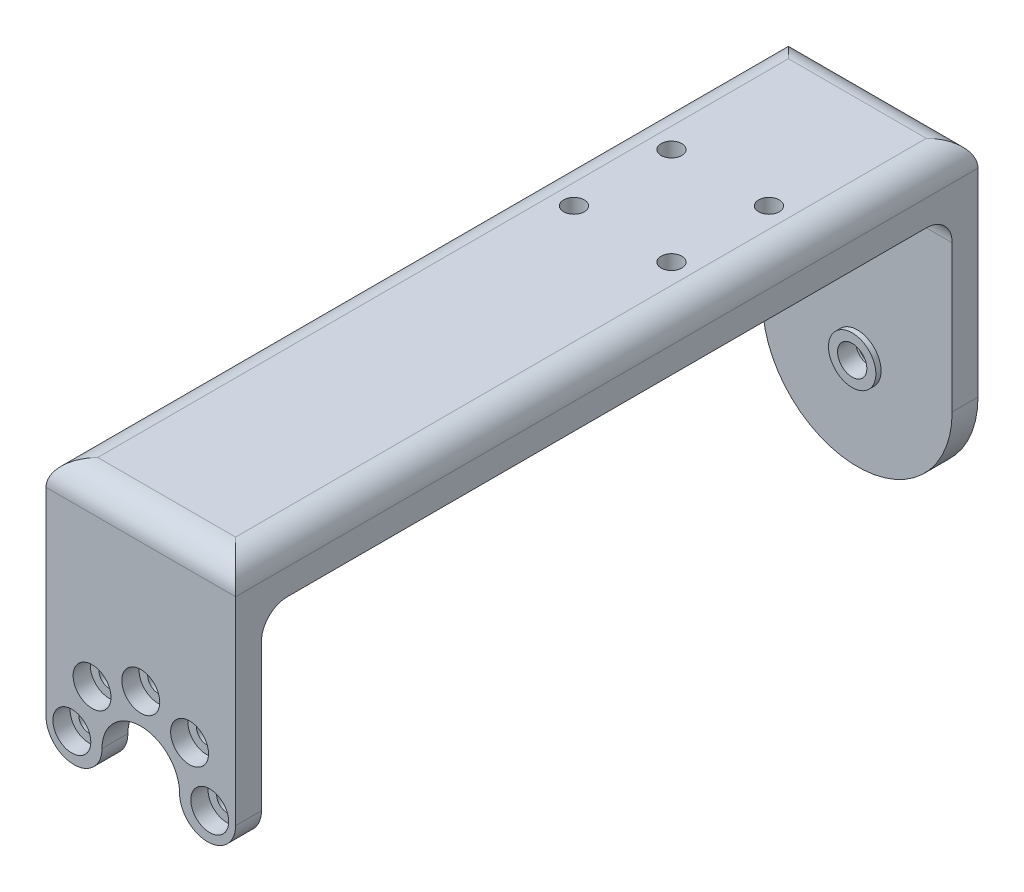
from build123d import *

# Parameters (mm, degrees)
RESSALTO_EXTRUS_O1_DEPTH                             = 3
ESBO_O2_W                                            = 22
ESBO_O2_H                                            = 86.15
RESSALTO_EXTRUS_O2_DEPTH                             = 3
RESSALTO_EXTRUS_O3_DEPTH                             = 3
REBAIXO_PARA_SHCS_M21_D                              = 2.4
REBAIXO_PARA_SHCS_M21_DEPTH                          = 3
REBAIXO_PARA_SHCS_M21_CBORE_D                        = 4.4
REBAIXO_PARA_SHCS_M21_CBORE_DEPTH                    = 2
PADR_OCIRCULAR1_COUNT                                = 5
PADR_OCIRCULAR1_ANGLE                                = 180
ESBO_O10_R                                           = 2.75
RESSALTO_EXTRUS_O4_DEPTH                             = 0.6
REBAIXO_PARA_PARAFUSO_COM_CABE_A_PANELA_D            = 3.4
REBAIXO_PARA_PARAFUSO_COM_CABE_A_PANELA_CBORE_D      = 7
REBAIXO_PARA_PARAFUSO_COM_CABE_A_PANELA_CBORE_DEPTH  = 1.5
ESBO_O14_W                                           = 86.15
ESBO_O14_H                                           = 6
RESSALTO_EXTRUS_O5_DEPTH                             = 3
REBAIXO_PARA_PARAFUSO_COM_CABE_A_REDONDA_D           = 2.4
REBAIXO_PARA_PARAFUSO_COM_CABE_A_REDONDA_CBORE_D     = 4.4
REBAIXO_PARA_PARAFUSO_COM_CABE_A_REDONDA_CBORE_DEPTH = 1
FILETE2_R                                            = 3
FILETE1_R                                            = 3


with BuildPart() as part:
    # Esboço1 → Ressalto-extrusão1 (new body)
    with BuildSketch(Plane.XY):
        with BuildLine():
            Line((11, 0), (11, 23))
            Line((11, 23), (-11, 23))
            Line((-11, 23), (-11, 0))
            ThreePointArc((-11, 0), (-7.75, -3.25), (-4.5, 0))
            ThreePointArc((-4.5, 0), (0, 4.5), (4.5, 0))
            ThreePointArc((4.5, 0), (7.75, -3.25), (11, 0))
        make_face()
    extrude(amount=RESSALTO_EXTRUS_O1_DEPTH)

    # Esboço2 → Ressalto-extrusão2 (add)
    with BuildSketch(Plane(origin=(0, 23, 0), x_dir=(1, 0, 0), z_dir=(0, 1, 0))):
        with Locations((0, 40.075)):
            Rectangle(ESBO_O2_W, ESBO_O2_H)
    extrude(amount=RESSALTO_EXTRUS_O2_DEPTH)

    # Esboço3 → Ressalto-extrusão3 (add)
    with BuildSketch(Plane(origin=(0, 0, -80.15), x_dir=(-1, 0, 0), z_dir=(0, 0, -1))):
        with BuildLine():
            Line((-11, 0), (-11, 23))
            Line((-11, 23), (11, 23))
            Line((11, 23), (11, 0))
            ThreePointArc((11, 0), (0, -11), (-11, 0))
        make_face()
    extrude(amount=RESSALTO_EXTRUS_O3_DEPTH)

    # Rebaixo para SHCS M21
    with Locations(Plane.XY.offset(3)):
        with Locations((8, 0)):
            rebaixo_para_shcs_m21 = CounterBoreHole(REBAIXO_PARA_SHCS_M21_D / 2, REBAIXO_PARA_SHCS_M21_CBORE_D / 2, REBAIXO_PARA_SHCS_M21_CBORE_DEPTH, depth=REBAIXO_PARA_SHCS_M21_DEPTH)

    # PadrãoCircular1: Rebaixo para SHCS M21 ×5 about axis
    padr_ocircular1_axis = Axis((0, 0, 0), (0, 0, 1))
    for i in range(1, PADR_OCIRCULAR1_COUNT):
        add(rebaixo_para_shcs_m21.rotate(padr_ocircular1_axis, i * PADR_OCIRCULAR1_ANGLE / (PADR_OCIRCULAR1_COUNT - 1)), mode=Mode.SUBTRACT)

    # Esboço10 → Ressalto-extrusão4 (add)
    with BuildSketch(Plane.XY.offset(-80.15)):
        with Locations(Location((0, 0, 0), (0, 0, 180))):
            Circle(ESBO_O10_R)
    extrude(amount=RESSALTO_EXTRUS_O4_DEPTH)

    # Rebaixo para parafuso com cabeça panela de M31 (through all)
    with Locations(Plane(origin=(0, 0, -83.15), x_dir=(-1, 0, 0), z_dir=(0, 0, -1))):
        with Locations((0, 0)):
            CounterBoreHole(REBAIXO_PARA_PARAFUSO_COM_CABE_A_PANELA_D / 2, REBAIXO_PARA_PARAFUSO_COM_CABE_A_PANELA_CBORE_D / 2, REBAIXO_PARA_PARAFUSO_COM_CABE_A_PANELA_CBORE_DEPTH)

    # Esboço14 → Ressalto-extrusão5 (add)
    with BuildSketch(Plane.ZY.offset(11)):
        with Locations((-40.075, 23)):
            Rectangle(ESBO_O14_W, ESBO_O14_H)
    ressalto_extrus_o5 = extrude(amount=-RESSALTO_EXTRUS_O5_DEPTH)

    # Espelhar2: Ressalto-extrusão5 across plane
    add(ressalto_extrus_o5.mirror(Plane(origin=(0, 0, 0), x_dir=(0, 0, 1), z_dir=(1, 0, 0))))

    # Rebaixo para parafuso com cabeça redonda de M21 (through all)
    with Locations(Plane(origin=(0, 23, 0), x_dir=(-1, 0, 0), z_dir=(0, -1, 0))):
        with Locations((5.656854249, 64.236417264), (5.656854249, 52.922708765), (-5.656854249, 52.922708765), (-5.656854249, 64.236417264)):
            CounterBoreHole(REBAIXO_PARA_PARAFUSO_COM_CABE_A_REDONDA_D / 2, REBAIXO_PARA_PARAFUSO_COM_CABE_A_REDONDA_CBORE_D / 2, REBAIXO_PARA_PARAFUSO_COM_CABE_A_REDONDA_CBORE_DEPTH)

    # Filete2
    filete2_edges = [part.edges().sort_by_distance(p)[0] for p in [
        (-9.5, 20, -80.15),
        (-9.5, 20, 0),
        (9.5, 20, -80.15),
        (9.5, 20, 0),
    ]]
    fillet(filete2_edges, radius=FILETE2_R)

    # Filete1
    # the kernel refuses this fillet: 3 mm, written as the material it adds along each edge
    with BuildSketch(Plane(origin=(8, 23, -80.15), x_dir=(0, 0, 1), z_dir=(-1, 0, 0))) as filete1_piece_1:
        with BuildLine():
            CenterArc((FILETE1_R, -FILETE1_R), FILETE1_R, 90, 90)
            Line((0, -FILETE1_R), (0, 0))
            Line((0, 0), (FILETE1_R, 0))
        make_face()
    extrude(amount=16)
    with BuildSketch(Plane(origin=(-8, 23, 0), x_dir=(0, -1, 0), z_dir=(0, 0, -1))) as filete1_piece_2_section:
        with BuildLine():
            CenterArc((FILETE1_R, -FILETE1_R), FILETE1_R, 90, 90)
            Line((0, -FILETE1_R), (0, 0))
            Line((0, 0), (FILETE1_R, 0))
        make_face()
    filete1_piece_2 = extrude(amount=80.15, mode=Mode.PRIVATE)
    filete1_piece_2 = filete1_piece_2 - Plane(origin=(-5.656854249, 22.304141759, -52.922708765), x_dir=(-1, 0, 0), z_dir=(0, -1, 0)) * Cylinder(2.2, 173, mode=Mode.PRIVATE)
    filete1_piece_2 = filete1_piece_2 - Plane(origin=(-5.656854249, 22.304141759, -64.236417264), x_dir=(-1, 0, 0), z_dir=(0, -1, 0)) * Cylinder(2.2, 173, mode=Mode.PRIVATE)
    add(filete1_piece_2)
    with BuildSketch(Plane(origin=(8, 23, 0), x_dir=(0, 0, -1), z_dir=(-1, 0, 0))) as filete1_piece_3:
        with BuildLine():
            CenterArc((FILETE1_R, FILETE1_R), FILETE1_R, 180, 90)
            Line((0, FILETE1_R), (0, 0))
            Line((0, 0), (FILETE1_R, 0))
        make_face()
    extrude(amount=16)
    with BuildSketch(Plane(origin=(8, 23, 0), x_dir=(-1, 0, 0), z_dir=(0, 0, -1))) as filete1_piece_4_section:
        with BuildLine():
            CenterArc((FILETE1_R, -FILETE1_R), FILETE1_R, 90, 90)
            Line((0, -FILETE1_R), (0, 0))
            Line((0, 0), (FILETE1_R, 0))
        make_face()
    filete1_piece_4 = extrude(amount=80.15, mode=Mode.PRIVATE)
    filete1_piece_4 = filete1_piece_4 - Plane(origin=(5.656854249, 22.30418368, -52.922708765), x_dir=(-1, 0, 0), z_dir=(0, -1, 0)) * Cylinder(2.2, 173, mode=Mode.PRIVATE)
    filete1_piece_4 = filete1_piece_4 - Plane(origin=(5.656854249, 22.30418368, -64.236417264), x_dir=(-1, 0, 0), z_dir=(0, -1, 0)) * Cylinder(2.2, 173, mode=Mode.PRIVATE)
    add(filete1_piece_4)
    # the kernel refuses this fillet: 3 mm, written as the material it takes off along each edge
    with BuildSketch(Plane(origin=(-11, 26, -90.65), x_dir=(0, -1, 0), z_dir=(0, 0, 1)), Plane(origin=(11, 26, 10.5), x_dir=(0, -1, 0), z_dir=(0, 0, -1))) as filete1_2_piece_1:
        with BuildLine():
            CenterArc((FILETE1_R, FILETE1_R), FILETE1_R, 180, 90)
            Line((0, FILETE1_R), (0, 0))
            Line((0, 0), (FILETE1_R, 0))
        make_face()
    extrude(amount=101.15, mode=Mode.SUBTRACT)
    with BuildSketch(Plane(origin=(18.5, 26, 3), x_dir=(0, 0, -1), z_dir=(-1, 0, 0)), Plane(origin=(18.5, 26, -83.15), x_dir=(0, -1, 0), z_dir=(-1, 0, 0))) as filete1_2_piece_2:
        with BuildLine():
            CenterArc((FILETE1_R, FILETE1_R), FILETE1_R, 180, 90)
            Line((0, FILETE1_R), (0, 0))
            Line((0, 0), (FILETE1_R, 0))
        make_face()
    extrude(amount=37, mode=Mode.SUBTRACT)


solid = part.part
